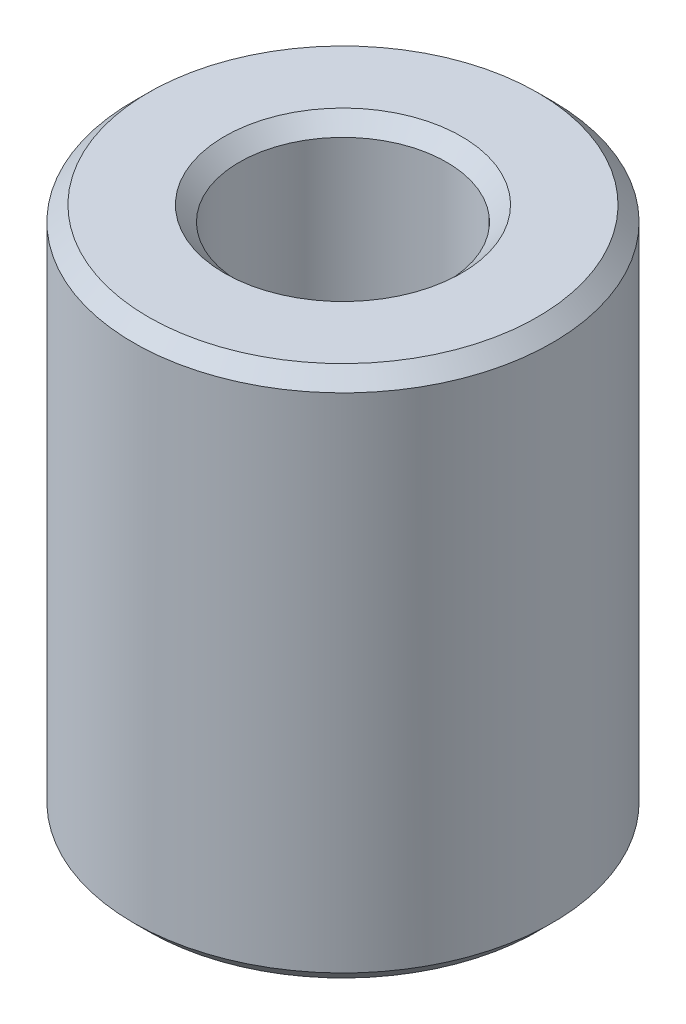
from build123d import *

# Parameters (mm, degrees)
SKETCH1_R           = 7.5
BOSS_EXTRUDE1_DEPTH = 19.059878299
SKETCH2_R           = 3.712484411
CUT_EXTRUDE1_DEPTH  = 22.812357983
CHAMFER1_SIZE       = 0.53251683


with BuildPart() as part:
    # Sketch1 → Boss-Extrude1 (new body)
    with BuildSketch(Plane(origin=(0, 0, 0), x_dir=(1, 0, 0), z_dir=(0, 1, 0))):
        Circle(SKETCH1_R)
    extrude(amount=BOSS_EXTRUDE1_DEPTH)

    # Sketch2 → Cut-Extrude1 (cut, through all)
    with BuildSketch(Plane(origin=(0, 0, 0), x_dir=(1, 0, 0), z_dir=(0, 1, 0))):
        Circle(SKETCH2_R)
    extrude(amount=CUT_EXTRUDE1_DEPTH, mode=Mode.SUBTRACT)

    # Chamfer1
    chamfer1_edges = [part.edges().sort_by_distance(p)[0] for p in [
        (-3.712484411, 19.059878299, 0),
        (-3.712484411, 0, 0),
        (-7.5, 0, 0),
        (-7.5, 19.059878299, 0),
    ]]
    chamfer(chamfer1_edges, length=CHAMFER1_SIZE)


solid = part.part
